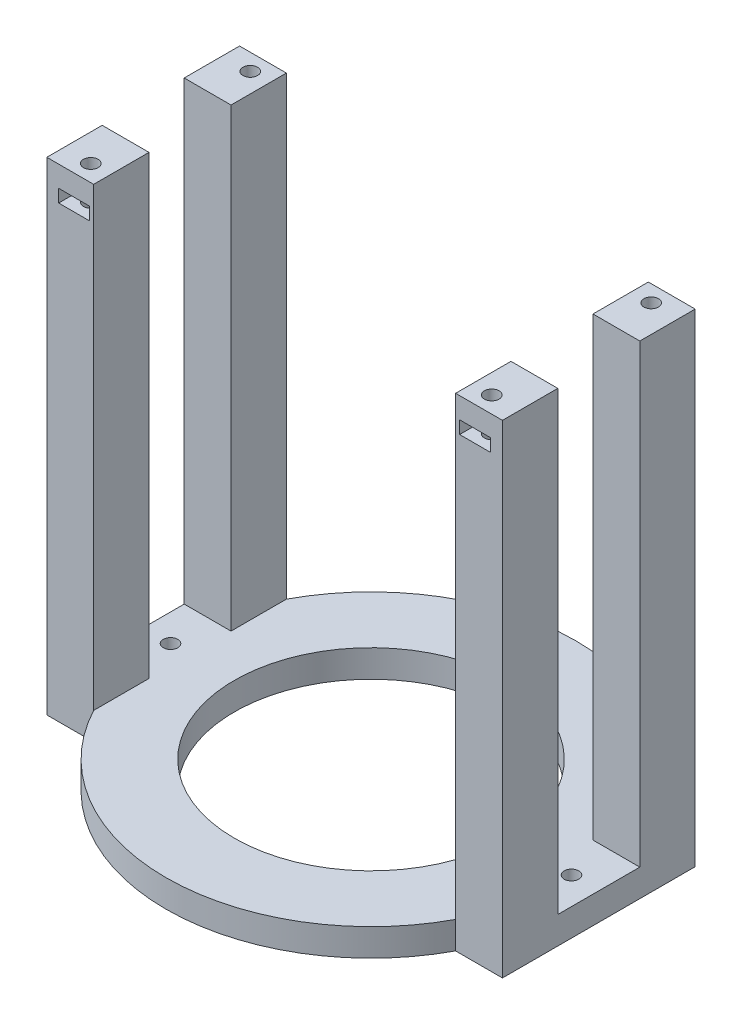
from build123d import *

# Parameters (mm, degrees)
BODY_DEPTH                = 6
SKETCH2_W                 = 10.280011329
SKETCH2_H                 = 42.3
WINGS_DEPTH               = 100
SKETCH3_R                 = 1.6
MOUNTING_BORE_DEPTH       = 126.54282138
CUT_EXCESS_MATERIAL_DEPTH = 153.515572975
CUT_HARNESS_MOUNT_REACH   = 127.543
SKETCH6_R                 = 1.6
SKETCH8_W                 = 6.8
SKETCH8_H                 = 2.8
CAPTURE_NUT_1_DEPTH       = 7.3
CIRPATTERN1_COUNT         = 2
CAPTURE_NUT_2_DEPTH       = 7.3
CIRPATTERN2_COUNT         = 2
CUT_EXTRUDE5_REACH        = 127.543
SKETCH11_R                = 30


with BuildPart() as part:
    # Sketch1 → body (new body)
    with BuildSketch(Plane(origin=(0, 0, 0), x_dir=(1, 0, 0), z_dir=(0, 1, 0))):
        with BuildLine():
            ThreePointArc((-39.719988671, -21.15), (0, -45), (39.719988671, -21.15))
            Line((39.719988671, -21.15), (50, -21.15))
            Line((50, -21.15), (50, 21.15))
            Line((50, 21.15), (39.719988671, 21.15))
            ThreePointArc((39.719988671, 21.15), (0, 45), (-39.719988671, 21.15))
            Line((-39.719988671, 21.15), (-50, 21.15))
            Line((-50, 21.15), (-50, -21.15))
            Line((-50, -21.15), (-39.719988671, -21.15))
        make_face()
    extrude(amount=BODY_DEPTH)

    # Sketch2 → wings (add)
    with BuildSketch(Plane(origin=(0, 6, 0), x_dir=(1, 0, 0), z_dir=(0, 1, 0))):
        with Locations((-44.859994336, 0)):
            Rectangle(SKETCH2_W, SKETCH2_H)
        with Locations((44.859994336, 0)):
            Rectangle(SKETCH2_W, SKETCH2_H)
    extrude(amount=WINGS_DEPTH)

    # Sketch3 → mounting-bore (cut, through all)
    with BuildSketch(Plane(origin=(0, 106, 0), x_dir=(1, 0, 0), z_dir=(0, 1, 0))):
        with Locations((44, -17.5)):
            Circle(SKETCH3_R)
        with Locations((-44, -17.5)):
            Circle(SKETCH3_R)
        with Locations((-44, 17.5)):
            Circle(SKETCH3_R)
        with Locations((44, 17.5)):
            Circle(SKETCH3_R)
    extrude(amount=-MOUNTING_BORE_DEPTH, mode=Mode.SUBTRACT)

    # Sketch5 → cut-excess-material (cut, through all)
    with BuildSketch(Plane(origin=(50, 0, 0), x_dir=(0, 0, -1), z_dir=(1, 0, 0))):
        Polygon((0, 6), (9, 6), (9, 106), (-9, 106), (-9, 6), align=None)
    extrude(amount=-CUT_EXCESS_MATERIAL_DEPTH, mode=Mode.SUBTRACT)

    # Sketch6 → cut-harness-mount (cut, up to next)
    with BuildSketch(Plane.XZ, mode=Mode.PRIVATE) as cut_harness_mount_sk1:
        with Locations((44, 0)):
            Circle(SKETCH6_R)
    cut_harness_mount_tool1 = extrude(cut_harness_mount_sk1.sketch, amount=-CUT_HARNESS_MOUNT_REACH, mode=Mode.PRIVATE) & part.part
    # Sketch6 → cut-harness-mount (cut, up to next)
    with BuildSketch(Plane.XZ, mode=Mode.PRIVATE) as cut_harness_mount_sk2:
        with Locations((-44, 0)):
            Circle(SKETCH6_R)
    cut_harness_mount_tool2 = extrude(cut_harness_mount_sk2.sketch, amount=-CUT_HARNESS_MOUNT_REACH, mode=Mode.PRIVATE) & part.part
    add(cut_harness_mount_tool1.solids().sort_by_distance((44, 0, 0))[0], mode=Mode.SUBTRACT)
    add(cut_harness_mount_tool2.solids().sort_by_distance((-44, 0, 0))[0], mode=Mode.SUBTRACT)

    # Sketch8 → capture-nut-1 (cut)
    with BuildSketch(Plane.XY.offset(21.15)):
        with Locations((43.999988671, 100)):
            Rectangle(SKETCH8_W, SKETCH8_H)
    capture_nut_1 = extrude(amount=-CAPTURE_NUT_1_DEPTH, mode=Mode.SUBTRACT)

    # CirPattern1: capture-nut-1 ×2 about axis
    cirpattern1_axis = Axis((0, 6, 0), (0, 1, 0))
    for i in range(1, CIRPATTERN1_COUNT):
        add(capture_nut_1.rotate(cirpattern1_axis, i * 360 / CIRPATTERN1_COUNT), mode=Mode.SUBTRACT)

    # Sketch10 → capture-nut-2 (cut)
    with BuildSketch(Plane(origin=(0, 0, -21.15), x_dir=(-1, 0, 0), z_dir=(0, 0, -1))):
        Polygon((-43.999988671, 101.4), (-47.399988671, 101.4), (-47.399988671, 98.6), (-40.599988671, 98.6), (-40.599988671, 101.4), align=None)
    capture_nut_2 = extrude(amount=-CAPTURE_NUT_2_DEPTH, mode=Mode.SUBTRACT)

    # CirPattern2: capture-nut-2 ×2 about axis
    cirpattern2_axis = Axis((0, 6, 0), (0, 1, 0))
    for i in range(1, CIRPATTERN2_COUNT):
        add(capture_nut_2.rotate(cirpattern2_axis, i * 360 / CIRPATTERN2_COUNT), mode=Mode.SUBTRACT)

    # Sketch11 → Cut-Extrude5 (cut, up to next)
    with BuildSketch(Plane.XZ, mode=Mode.PRIVATE) as cut_extrude5_sk1:
        Circle(SKETCH11_R)
    cut_extrude5_tool1 = extrude(cut_extrude5_sk1.sketch, amount=-CUT_EXTRUDE5_REACH, mode=Mode.PRIVATE) & part.part
    add(cut_extrude5_tool1.solids().sort_by_distance((0, 0, 0))[0], mode=Mode.SUBTRACT)


solid = part.part
